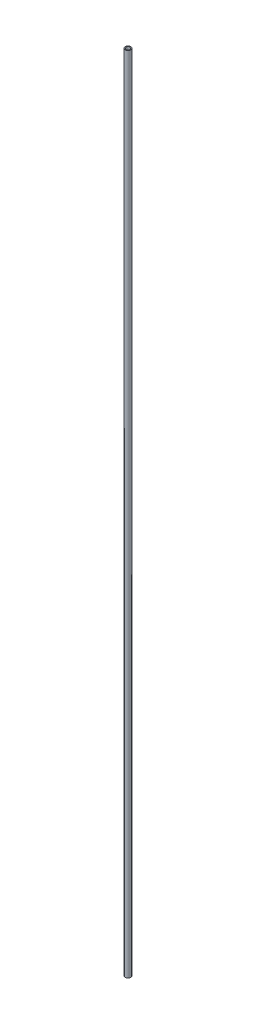
from build123d import *

# Parameters (mm, degrees)
SKETCH1_R           = 10.668
SKETCH1_R_2         = 7.6454
BOSS_EXTRUDE1_DEPTH = 3048


with BuildPart() as part:
    # Sketch1 → Boss-Extrude1 (new body)
    with BuildSketch(Plane(origin=(0, 0, 0), x_dir=(1, 0, 0), z_dir=(0, 1, 0))):
        Circle(SKETCH1_R)
        Circle(SKETCH1_R_2, mode=Mode.SUBTRACT)
    extrude(amount=BOSS_EXTRUDE1_DEPTH)


solid = part.part
